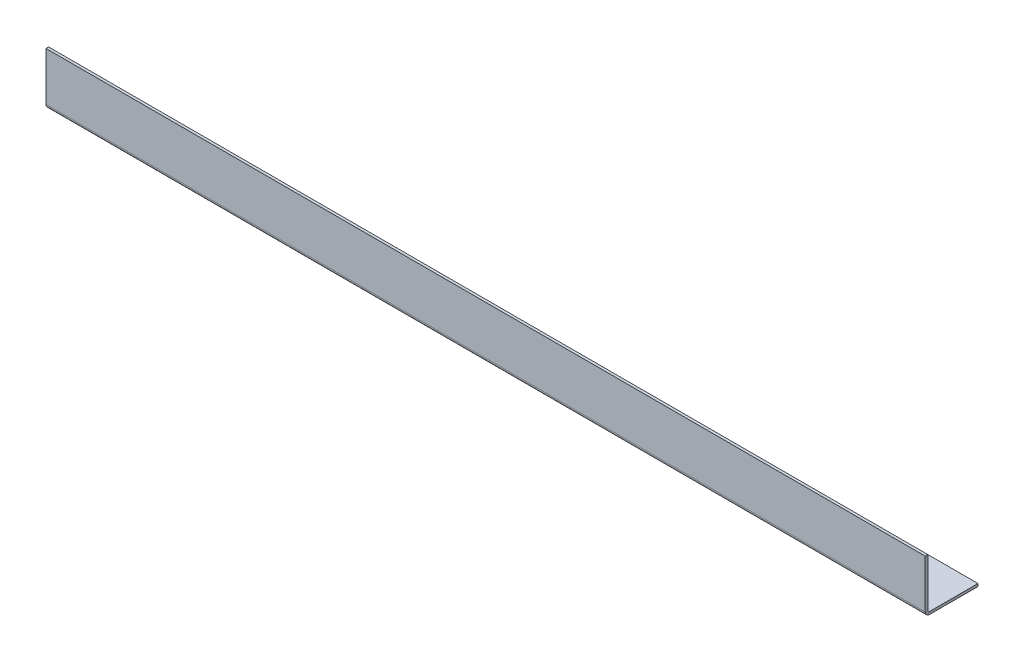
from build123d import *

# Parameters (mm, degrees)
BOSS_EXTRUDE1_DEPTH = 500
FILLET1_R           = 5


with BuildPart() as part:
    # Sketch1 → Boss-Extrude1 (new, symmetric)
    with BuildSketch(Plane(origin=(0, 0, 0), x_dir=(0, 0, -1), z_dir=(1, 0, 0))):
        Polygon((0, 0), (0, 60), (3, 60), (3, 3), (60, 3), (60, 0), align=None)
    extrude(amount=BOSS_EXTRUDE1_DEPTH, both=True)

    # Fillet1
    fillet1_edges = [part.edges().sort_by_distance(p)[0] for p in [
        (0, 0, 0),
    ]]
    fillet(fillet1_edges, radius=FILLET1_R)


solid = part.part
